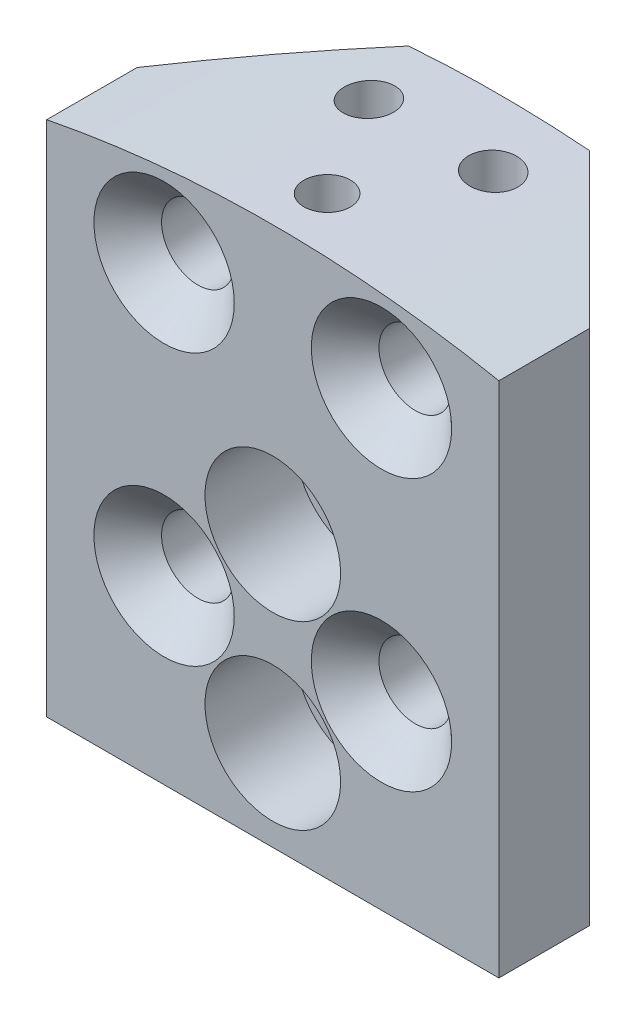
from build123d import *

# Parameters (mm, degrees)
SKETCH1_W                    = 50.8
SKETCH1_H                    = 38.1
BOSS_EXTRUDE1_DEPTH          = 15.875
F_1_4_20_TAPPED_HOLE1_D      = 5.1054
CUT_EXTRUDE1_DEPTH           = 36.497579143
CUT_EXTRUDE1_DEPTH_BACK      = 36.497579143
SKETCH5_W                    = 73.284203365
SKETCH5_H                    = 114.763304797
CUT_EXTRUDE3_DEPTH           = 36.497579143
CUT_EXTRUDE3_DRAFT           = 45
CUT_EXTRUDE3_PROFILE_2_DEPTH = 36.497579143
CUT_EXTRUDE3_PROFILE_2_DRAFT = 45
CUT_EXTRUDE5_DEPTH           = 34.299680929
CUT_EXTRUDE5_DEPTH_BACK      = 34.299680929
SKETCH7_W                    = 138.535058429
SKETCH7_H                    = 124.054324336
SKETCH7_W_2                  = 31.75
SKETCH7_H_2                  = 70.377244636
F_1_4_20_TAPPED_HOLE2_D      = 5.1054
F_8_32_TAPPED_HOLE1_D        = 3.4544
F_8_32_TAPPED_HOLE1_DEPTH    = 12.7
F_8_32_TAPPED_HOLE1_TIP      = 1.037806461
CUT_EXTRUDE6_DEPTH           = 6.35
SKETCH14_R                   = 4.7625
CUT_EXTRUDE7_DEPTH           = 6.35


# Read off the part's stored shape, not the designer's step: LPattern1
with BuildPart() as part:
    # Sketch1 → Boss-Extrude1 (new body)
    with BuildSketch(Plane.XY):
        Rectangle(SKETCH1_W, SKETCH1_H)
    extrude(amount=BOSS_EXTRUDE1_DEPTH)

    # 1/4-20 Tapped Hole1 (through all)
    with Locations(Plane.XY.offset(15.875)):
        with Locations((7.6327, 12.7), (-7.6327, 12.7)):
            Hole(F_1_4_20_TAPPED_HOLE1_D / 2)

    # Sketch4 → Cut-Extrude1 (cut, two sides: drawn at the far end of the back side and taken through both)
    with BuildSketch(Plane.XY.offset(15.875).offset(-CUT_EXTRUDE1_DEPTH_BACK)):
        with BuildLine():
            Line((-39.282326984, 8.793789894), (-52.704404265, 33.364356416))
            Line((-52.704404265, 33.364356416), (0, 61.927684543))
            Line((0, 61.927684543), (62.667848215, 36.771765562))
            Line((62.667848215, 36.771765562), (48.5918884, 2.86093959))
            ThreePointArc((48.5918884, 2.86093959), (5.519661368, 18.637515941), (-39.282326984, 8.793789894))
        make_face()
    extrude(amount=CUT_EXTRUDE1_DEPTH + CUT_EXTRUDE1_DEPTH_BACK, mode=Mode.SUBTRACT)


with BuildPart() as cut_extrude3_tool:
    # Sketch5 → Cut-Extrude3 (with draft: the straight prism first)
    with BuildSketch(Plane.XY):
        with Locations((-42.992101682, 7.874882724)):
            Rectangle(SKETCH5_W, SKETCH5_H)
    extrude(amount=CUT_EXTRUDE3_DEPTH)
    # Cut-Extrude3: the draft: its side faces are tilted about the plane it starts from
    cut_extrude3_sides = [cut_extrude3_tool.faces().sort_by_distance(p)[0] for p in [
        (-42.992101682, 65.256535122, 18.248789571),
        (-79.634203365, 7.874882724, 18.248789571),
        (-42.992101682, -49.506769675, 18.248789571),
        (-6.35, 7.874882724, 18.248789571),
    ]]
    draft(cut_extrude3_sides, Plane.XY, CUT_EXTRUDE3_DRAFT)


with BuildPart() as part_1:
    add(part.part)

    # Cut-Extrude3: cut by cut_extrude3_tool
    add(cut_extrude3_tool.part, mode=Mode.SUBTRACT)


with BuildPart() as cut_extrude3_profile_2_tool:
    # Sketch5 → Cut-Extrude3 profile 2 (with draft: the straight prism first)
    with BuildSketch(Plane.XY):
        with Locations((42.992101682, 7.874882724)):
            Rectangle(SKETCH5_W, SKETCH5_H)
    extrude(amount=CUT_EXTRUDE3_PROFILE_2_DEPTH)
    # Cut-Extrude3 profile 2: the draft: its side faces are tilted about the plane it starts from
    cut_extrude3_profile_2_sides = [cut_extrude3_profile_2_tool.faces().sort_by_distance(p)[0] for p in [
        (42.992101682, 65.256535122, 18.248789571),
        (6.35, 7.874882724, 18.248789571),
        (42.992101682, -49.506769675, 18.248789571),
        (79.634203365, 7.874882724, 18.248789571),
    ]]
    draft(cut_extrude3_profile_2_sides, Plane.XY, CUT_EXTRUDE3_PROFILE_2_DRAFT)


with BuildPart() as part_2:
    add(part_1.part)

    # Cut-Extrude3 profile 2: cut by cut_extrude3_profile_2_tool
    add(cut_extrude3_profile_2_tool.part, mode=Mode.SUBTRACT)

    # Cut-Extrude4 cone 1 section (through the dimple's axis) → Cut-Extrude4 (revolve, cut)
    with BuildSketch(Plane(origin=(-7.6327, 12.7, 15.875), x_dir=(0, -1, 0), z_dir=(1, 0, 0))):
        Polygon((0, 0), (4.9276, 0), (0, 4.9276), align=None)
    revolve(axis=Axis((-7.6327, 12.7, 15.875), (0, 0, -1)), mode=Mode.SUBTRACT)

    # Cut-Extrude4 cone 2 section (through the dimple's axis) → Cut-Extrude4 cone 2 (revolve, cut)
    with BuildSketch(Plane(origin=(7.6327, 12.7, 15.875), x_dir=(0, -1, 0), z_dir=(1, 0, 0))):
        Polygon((0, 0), (4.9276, 0), (0, 4.9276), align=None)
    revolve(axis=Axis((7.6327, 12.7, 15.875), (0, 0, -1)), mode=Mode.SUBTRACT)

    # Sketch7 → Cut-Extrude5 (cut, two sides: drawn at the far end of the back side and taken through both)
    with BuildSketch(Plane.XY.offset(15.875).offset(-CUT_EXTRUDE5_DEPTH_BACK)):
        with Locations((-4.796027088, -12.18557991)):
            Rectangle(SKETCH7_W, SKETCH7_H)
        Rectangle(SKETCH7_W_2, SKETCH7_H_2, mode=Mode.SUBTRACT)
    extrude(amount=CUT_EXTRUDE5_DEPTH + CUT_EXTRUDE5_DEPTH_BACK, mode=Mode.SUBTRACT)

    # 1/4-20 Tapped Hole2 (through all)
    with Locations(Plane.XY.offset(15.875)):
        with Locations((0, -12.7), (0, 0)):
            Hole(F_1_4_20_TAPPED_HOLE2_D / 2)

    # #8-32 Tapped Hole1
    with Locations(Plane(origin=(0, 19.05, 0), x_dir=(-1, 0, 0), z_dir=(0, 1, 0))):
        with Locations((4.365625, 4.7625), (-4.365625, 4.7625)):
            Hole(F_8_32_TAPPED_HOLE1_D / 2, depth=F_8_32_TAPPED_HOLE1_DEPTH)
            with Locations((0, 0, -(F_8_32_TAPPED_HOLE1_DEPTH + F_8_32_TAPPED_HOLE1_TIP / 2))):  # 118° drill point
                Cone(0, F_8_32_TAPPED_HOLE1_D / 2, F_8_32_TAPPED_HOLE1_TIP, mode=Mode.SUBTRACT)

    # Sketch13 → Cut-Extrude6 (cut)
    with BuildSketch(Plane(origin=(0, 19.05, 0), x_dir=(-1, 0, 0), z_dir=(0, -1, 0))):
        with BuildLine():
            add(Edge.make_bspline(
                [(1.630169721, -12.065), (1.630169721, -8.8011), (-1.633730278, -8.8011), (-1.633730278, -12.065), (-1.633730278, -15.3289), (1.630169721, -15.3289), (1.630169721, -12.065)],
                knots=[0, 0, 0, 0, 0.5, 0.5, 0.5, 1, 1, 1, 1], degree=3, weights=[1, 0.333333333, 0.333333333, 1, 0.333333333, 0.333333333, 1]))
        make_face()
    extrude(amount=CUT_EXTRUDE6_DEPTH, mode=Mode.SUBTRACT)

    # LPattern1 outline → LPattern1 (revolve, cut)
    with BuildSketch(Plane(origin=(-7.6327, -6.35, 0), x_dir=(1, 0, 0), z_dir=(0, -1, 0))):
        Polygon((0, 0), (2.5527, 0), (2.5527, 13.5001), (4.9276, 15.875), (0, 15.875), align=None)
    revolve(axis=Axis((-7.6327, -6.35, 0), (0, 0, 1)), mode=Mode.SUBTRACT)

    # LPattern1 2 outline → LPattern1 2 (revolve, cut)
    with BuildSketch(Plane(origin=(7.6327, -6.35, 0), x_dir=(1, 0, 0), z_dir=(0, -1, 0))):
        Polygon((0, 0), (2.5527, 0), (2.5527, 13.5001), (4.9276, 15.875), (0, 15.875), align=None)
    revolve(axis=Axis((7.6327, -6.35, 0), (0, 0, 1)), mode=Mode.SUBTRACT)

    # Sketch14 → Cut-Extrude7 (cut)
    with BuildSketch(Plane.XY.offset(15.875)):
        Circle(SKETCH14_R)
        with Locations((0, -12.7)):
            Circle(SKETCH14_R)
    extrude(amount=-CUT_EXTRUDE7_DEPTH, mode=Mode.SUBTRACT)


solid = part_2.part
